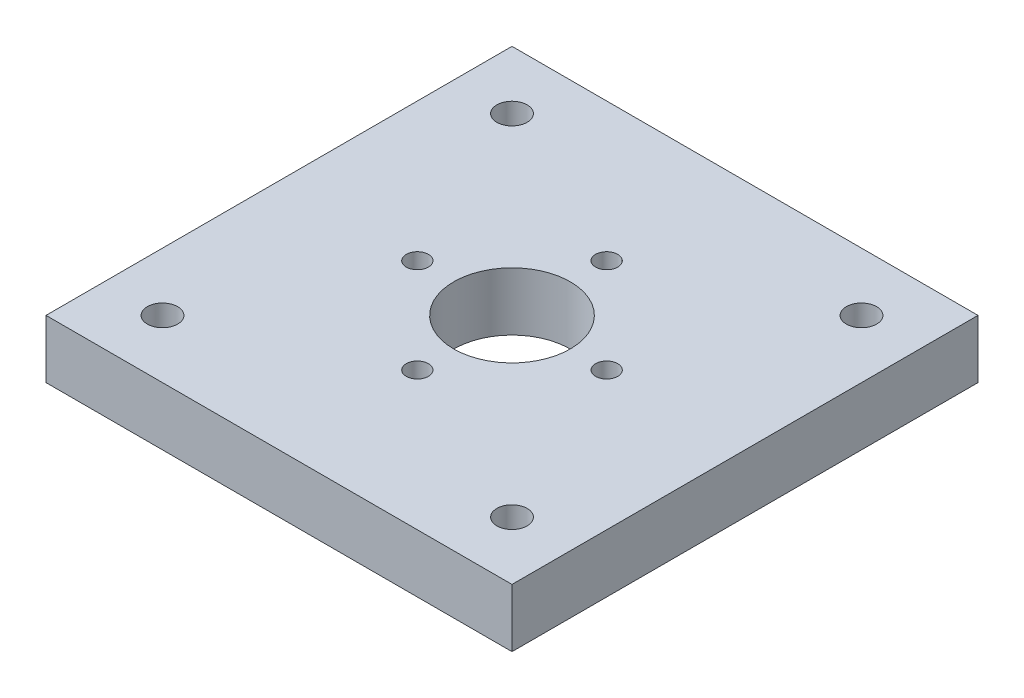
from build123d import *

# Parameters (mm, degrees)
SKETCH1_W           = 101.6
SKETCH1_H           = 101.6
SKETCH1_R           = 3.302
SKETCH1_R_2         = 12.7
SKETCH1_R_3         = 2.413
BOSS_EXTRUDE1_DEPTH = 6.35


with BuildPart() as part:
    # Sketch1 → Boss-Extrude1 (new, symmetric)
    with BuildSketch(Plane(origin=(0, 0, 0), x_dir=(1, 0, 0), z_dir=(0, 1, 0))):
        Rectangle(SKETCH1_W, SKETCH1_H)
        with Locations((-38.1, 38.1)):
            Circle(SKETCH1_R, mode=Mode.SUBTRACT)
        with Locations((-38.1, -38.1)):
            Circle(SKETCH1_R, mode=Mode.SUBTRACT)
        with Locations((38.1, -38.1)):
            Circle(SKETCH1_R, mode=Mode.SUBTRACT)
        with Locations((38.1, 38.1)):
            Circle(SKETCH1_R, mode=Mode.SUBTRACT)
        Circle(SKETCH1_R_2, mode=Mode.SUBTRACT)
        with Locations((0, 20.6375)):
            Circle(SKETCH1_R_3, mode=Mode.SUBTRACT)
        with Locations((0, -20.6375)):
            Circle(SKETCH1_R_3, mode=Mode.SUBTRACT)
        with Locations((-20.6375, 0)):
            Circle(SKETCH1_R_3, mode=Mode.SUBTRACT)
        with Locations((20.6375, 0)):
            Circle(SKETCH1_R_3, mode=Mode.SUBTRACT)
    extrude(amount=BOSS_EXTRUDE1_DEPTH, both=True)


solid = part.part
